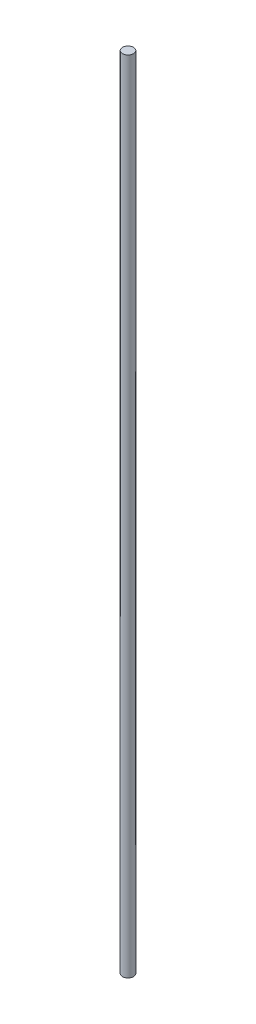
from build123d import *

# Parameters (mm, degrees)
SKETCH1_R           = 1
BOSS_EXTRUDE1_DEPTH = 145.3


with BuildPart() as part:
    # Sketch1 → Boss-Extrude1 (new body)
    with BuildSketch(Plane(origin=(0, 0, 0), x_dir=(1, 0, 0), z_dir=(0, 1, 0))):
        Circle(SKETCH1_R)
    extrude(amount=BOSS_EXTRUDE1_DEPTH)


solid = part.part
